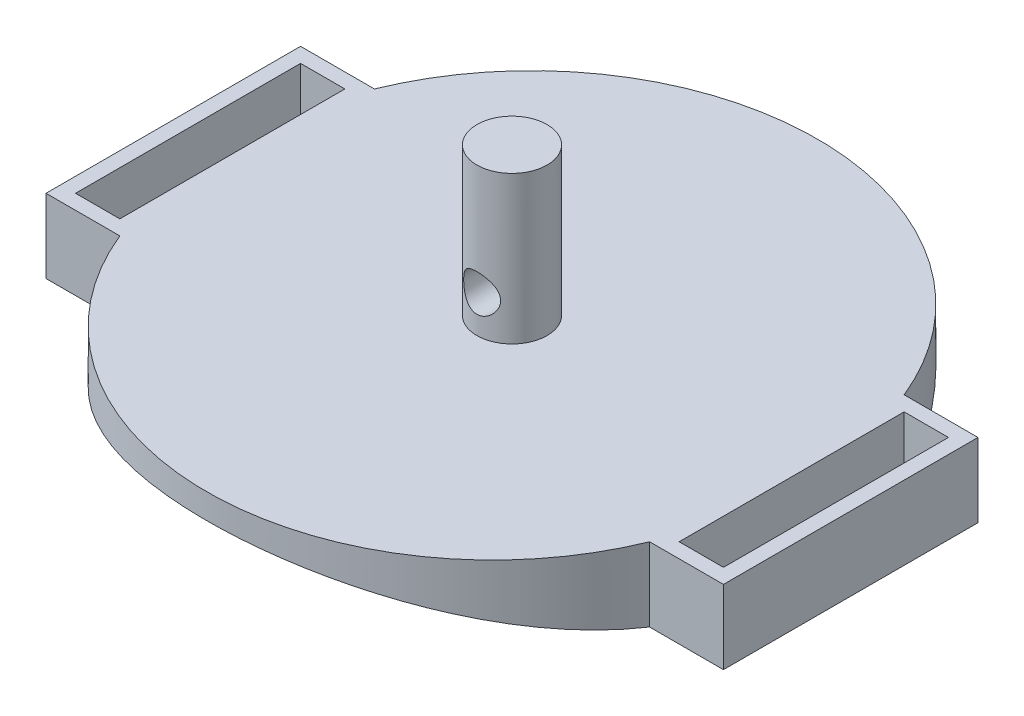
from build123d import *

# Parameters (mm, degrees)
SKETCH4_W           = 6
SKETCH4_H           = 30.460968249
BOSS_EXTRUDE3_DEPTH = 10
SKETCH5_R           = 4.75
BOSS_EXTRUDE4_DEPTH = 20
CUT_EXTRUDE1_REACH  = 73.611
SKETCH6_R           = 2.5
CUT_EXTRUDE2_REACH  = 101.208


with BuildPart() as part:
    # Sketch4 → Boss-Extrude3 (new body)
    with BuildSketch(Plane(origin=(0, 0, 0), x_dir=(1, 0, 0), z_dir=(0, 1, 0))):
        with BuildLine():
            Line((35.857927804, -48.738130517), (45.857927804, -48.738130517))
            Line((45.857927804, -48.738130517), (45.857927804, -14.277162268))
            Line((45.857927804, -14.277162268), (35.857927804, -14.277162268))
            ThreePointArc((35.857927804, -14.277162268), (0, 9.842170723), (-35.857927804, -14.277162268))
            Line((-35.857927804, -14.277162268), (-45.857927804, -14.277162268))
            Line((-45.857927804, -14.277162268), (-45.857927804, -48.738130517))
            Line((-45.857927804, -48.738130517), (-35.857927804, -48.738130517))
            ThreePointArc((-35.857927804, -48.738130517), (0, -72.857463508), (35.857927804, -48.738130517))
        make_face()
        with Locations((40.857927804, -31.507646392)):
            Rectangle(SKETCH4_W, SKETCH4_H, mode=Mode.SUBTRACT)
        with Locations((-40.857927804, -31.507646392)):
            Rectangle(SKETCH4_W, SKETCH4_H, mode=Mode.SUBTRACT)
    extrude(amount=BOSS_EXTRUDE3_DEPTH)

    # Sketch5 → Boss-Extrude4 (add)
    with BuildSketch(Plane(origin=(0, 10, 0), x_dir=(1, 0, 0), z_dir=(0, 1, 0))):
        with Locations((0, -31.507646393)):
            Circle(SKETCH5_R)
    extrude(amount=BOSS_EXTRUDE4_DEPTH)

    # Sketch6 → Cut-Extrude1 (cut, up to next)
    with BuildSketch(Plane(origin=(0, 0, 26.757646393), x_dir=(-1, 0, 0), z_dir=(0, 0, -1)), mode=Mode.PRIVATE) as cut_extrude1_sk1:
        with Locations((0, 15)):
            Circle(SKETCH6_R)
    cut_extrude1_tool1 = extrude(cut_extrude1_sk1.sketch, amount=-CUT_EXTRUDE1_REACH, mode=Mode.PRIVATE) & part.part
    add(cut_extrude1_tool1.solids().sort_by_distance((0, 15, 26.757646))[0], mode=Mode.SUBTRACT)

    # Sketch7 → Cut-Extrude2 (cut, up to next)
    with BuildSketch(Plane.XY.offset(72.857463508), mode=Mode.PRIVATE) as cut_extrude2_sk1:
        with BuildLine():
            Line((-35.857927804, 0), (35.857927804, 0))
            ThreePointArc((35.857927804, 0), (0, 6.606533037), (-35.857927804, 0))
        make_face()
    cut_extrude2_tool1 = extrude(cut_extrude2_sk1.sketch, amount=-CUT_EXTRUDE2_REACH, mode=Mode.PRIVATE) & part.part
    add(cut_extrude2_tool1.solids().sort_by_distance((0, 2.650194, 72.857464))[0], mode=Mode.SUBTRACT)


solid = part.part
